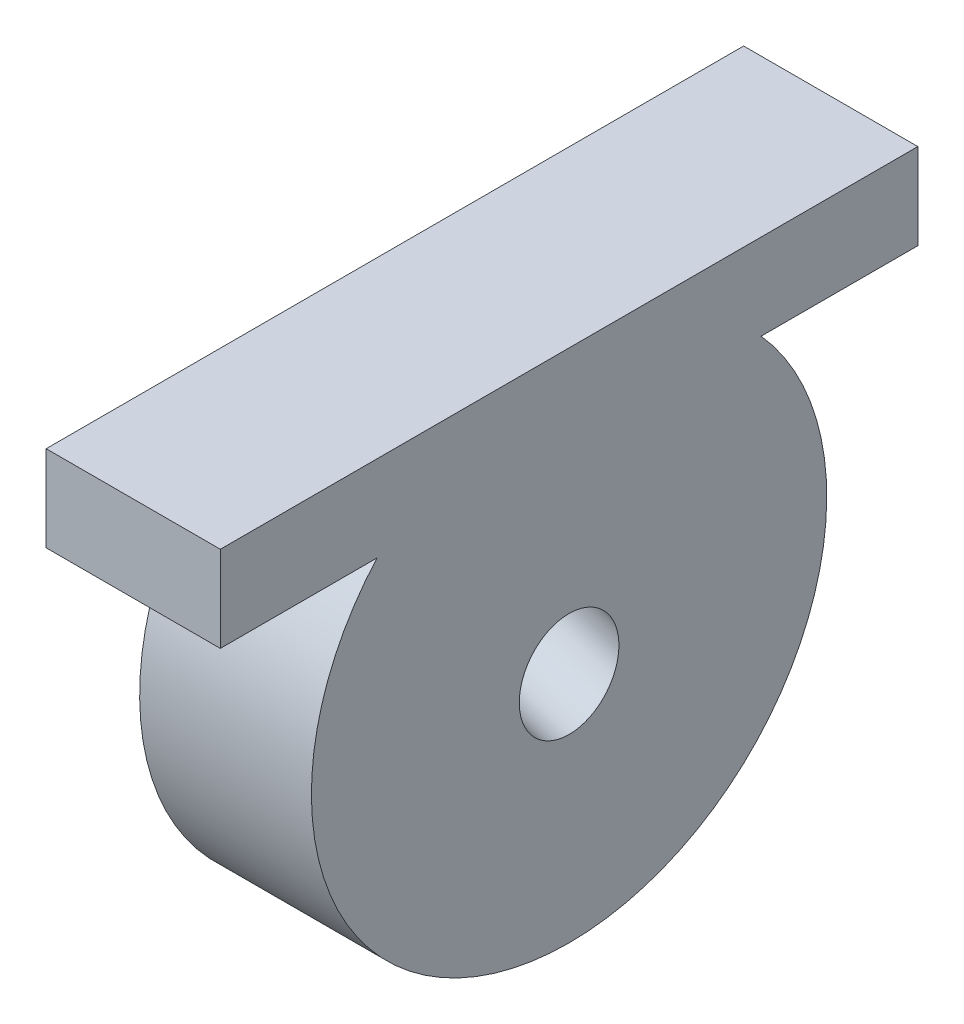
from build123d import *

# Parameters (mm, degrees)
SKETCH3_W            = 25.753050404
SKETCH3_H            = 103.137359271
BOSS_EXTRUDE1_DEPTH  = 12.7
SKETCH4_R            = 38.1
BOSS_EXTRUDE2_DEPTH  = 25.4
CUT_SWEEP1_PROFILE_R = 7.366


with BuildPart() as part:
    # Sketch3 → Boss-Extrude1 (new body)
    with BuildSketch(Plane(origin=(0, 717.636591226, 0), x_dir=(-1, 0, 0), z_dir=(0, -1, 0))):
        with Locations((-511.2749233, -660.547915429)):
            Rectangle(SKETCH3_W, SKETCH3_H)
    extrude(amount=BOSS_EXTRUDE1_DEPTH)

    # Sketch4 → Boss-Extrude2 (add)
    with BuildSketch(Plane(origin=(524.151448502, 0, 0), x_dir=(0, 0, -1), z_dir=(1, 0, 0))):
        with Locations((-660.547915428, 679.536591226)):
            Circle(SKETCH4_R)
    extrude(amount=-BOSS_EXTRUDE2_DEPTH)

    # Cut-Sweep1: sweep along a path in Sketch5
    with BuildLine(Plane.XY.offset(660.547915428)) as cut_sweep1_path:
        Line((472.45049051, 692.709335123), (547.766548789, 668.191368615))
    # Cut-Sweep1 profile (on start of the path) → Cut-Sweep1 (sweep, cut)
    with BuildSketch(Plane(origin=(472.45049051, 692.709335123, 660.547915428), x_dir=(0.3095456277751122, 0.9508845904342502, 0), z_dir=(0.9508845904342502, -0.3095456277751122, 0))):
        Circle(CUT_SWEEP1_PROFILE_R)
    sweep(path=cut_sweep1_path.line, mode=Mode.SUBTRACT)


solid = part.part
